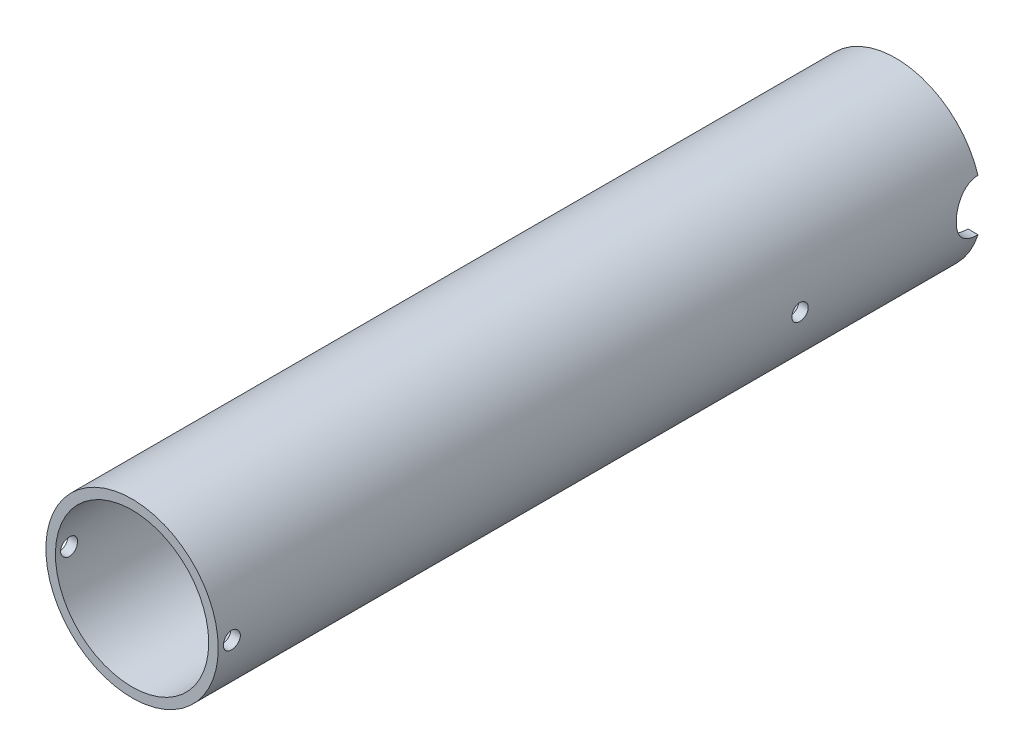
from build123d import *

# Parameters (mm, degrees)
SKETCH1_R               = 15.8
SKETCH1_R_2             = 14.05
EXTRUDE1_DEPTH          = 140
CUT_EXTRUDE1_DEPTH      = 142.771929521
CUT_EXTRUDE1_DEPTH_BACK = 142.771929521
SKETCH2_R               = 1.55
SKETCH2_R_2             = 4.71
SKETCH2_R_3             = 1.5


with BuildPart() as part:
    # Sketch1 → Extrude1 (new body)
    with BuildSketch(Plane.XY):
        Circle(SKETCH1_R)
        Circle(SKETCH1_R_2, mode=Mode.SUBTRACT)
    extrude(amount=EXTRUDE1_DEPTH)

    # Sketch2 → Cut-Extrude1 (cut, two sides: drawn at the far end of the back side and taken through both)
    with BuildSketch(Plane(origin=(0, 0, 0), x_dir=(0, 0, -1), z_dir=(1, 0, 0)).offset(-CUT_EXTRUDE1_DEPTH_BACK)):
        with Locations((-137.5, 0)):
            Circle(SKETCH2_R)
        Circle(SKETCH2_R_2)
        with Locations((-33.3375, 0)):
            Circle(SKETCH2_R_3)
    extrude(amount=CUT_EXTRUDE1_DEPTH + CUT_EXTRUDE1_DEPTH_BACK, mode=Mode.SUBTRACT)


solid = part.part
